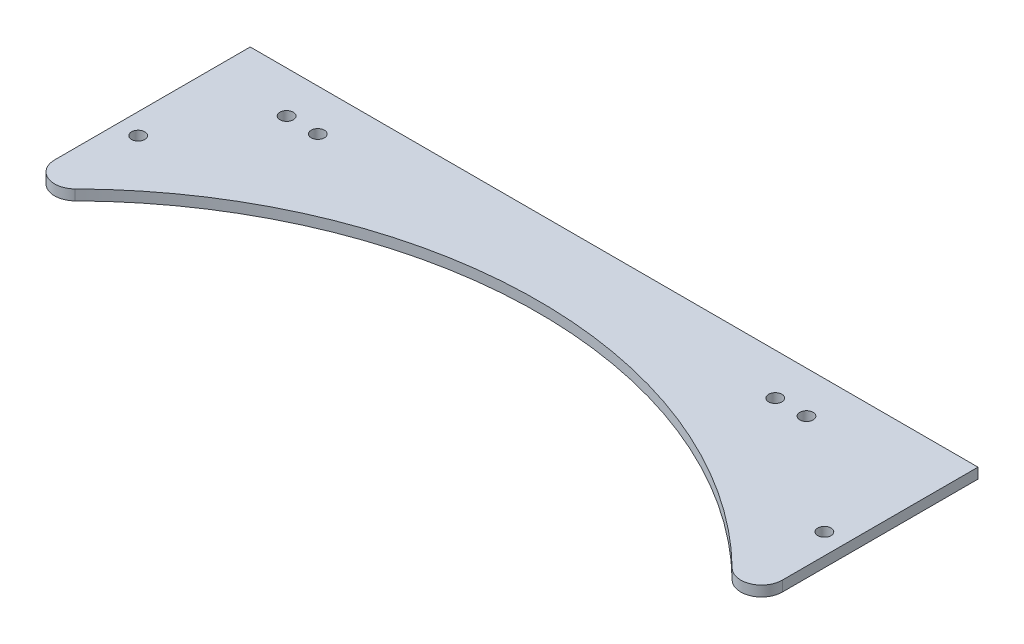
from build123d import *

# Parameters (mm, degrees)
SKETCH1_R           = 2.032
BOSS_EXTRUDE1_DEPTH = 3.175
SKETCH3_R           = 2.032
CUT_EXTRUDE1_DEPTH  = 235.971451723
FILLET1_R           = 6.35


with BuildPart() as part:
    # Sketch1 → Boss-Extrude1 (new body)
    with BuildSketch(Plane(origin=(0, 0, 0), x_dir=(1, 0, 0), z_dir=(0, 1, 0))):
        with BuildLine():
            Line((0, 0), (0, 76.2))
            Line((0, 76.2), (222.25, 76.2))
            Line((222.25, 76.2), (222.25, 0))
            ThreePointArc((222.25, 0), (111.125, 53.072438789), (0, 0))
        make_face()
        with Locations((6.35, 35.639000096)):
            Circle(SKETCH1_R, mode=Mode.SUBTRACT)
        with Locations((215.9, 35.639000096)):
            Circle(SKETCH1_R, mode=Mode.SUBTRACT)
    extrude(amount=BOSS_EXTRUDE1_DEPTH)

    # Sketch3 → Cut-Extrude1 (cut, through all)
    with BuildSketch(Plane.XZ):
        with Locations((33.3375, -63.5)):
            Circle(SKETCH3_R)
        with Locations((23.8125, -63.5)):
            Circle(SKETCH3_R)
        with Locations((182.5625, -63.5)):
            Circle(SKETCH3_R)
        with Locations((173.0375, -63.5)):
            Circle(SKETCH3_R)
    extrude(amount=-CUT_EXTRUDE1_DEPTH, mode=Mode.SUBTRACT)

    # Fillet1
    fillet1_edges = [part.edges().sort_by_distance(p)[0] for p in [
        (0, 1.5875, 0),
        (222.25, 1.5875, 0),
    ]]
    fillet(fillet1_edges, radius=FILLET1_R)


solid = part.part
